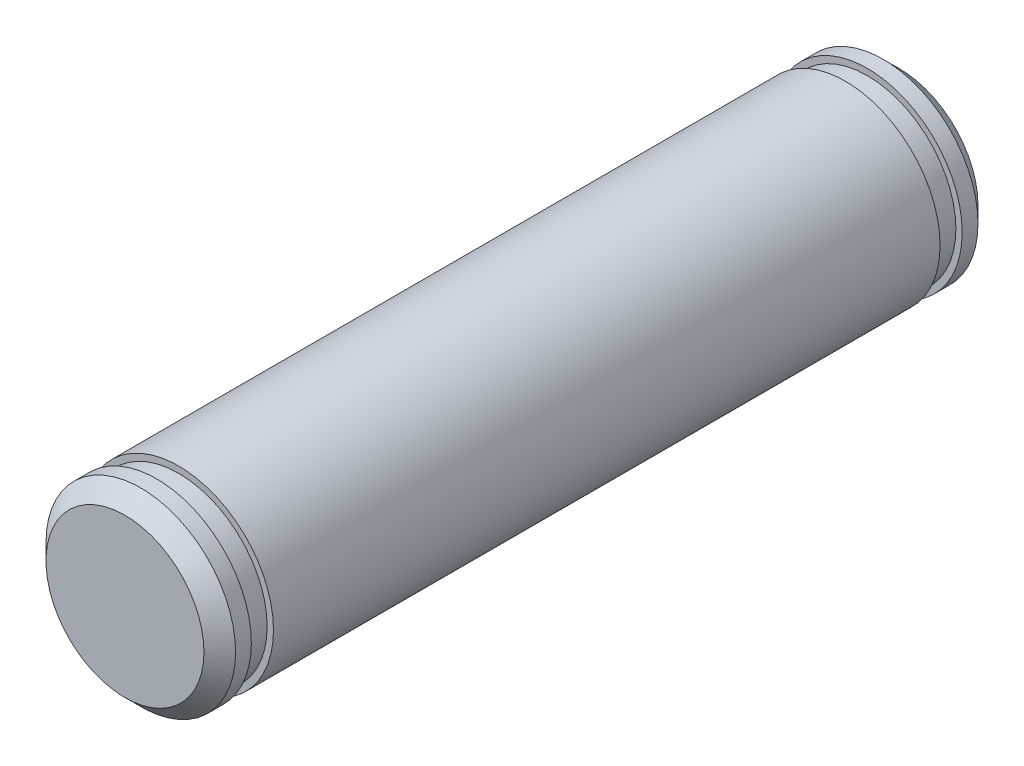
from build123d import *

# Parameters (mm, degrees)
SZKIC1_R                    = 3
DODANIE_WYCI_GNI_CIE1_DEPTH = 24.5
SFAZOWANIE1_SIZE            = 0.5
WYTNIJ_WYCI_GNI_CIE1_START  = -1.7
SZKIC2_R                    = 3
SZKIC2_R_2                  = 2.8
WYTNIJ_WYCI_GNI_CIE1_DEPTH  = 0.7
WYTNIJ_WYCI_GNI_CIE2_START  = -1
SZKIC3_R                    = 3
SZKIC3_R_2                  = 2.8
WYTNIJ_WYCI_GNI_CIE2_DEPTH  = 0.7


with BuildPart() as part:
    # Szkic1 → Dodanie-wyciągnięcie1 (new body)
    with BuildSketch(Plane.XY):
        Circle(SZKIC1_R)
    extrude(amount=DODANIE_WYCI_GNI_CIE1_DEPTH)

    # Sfazowanie1
    sfazowanie1_edges = [part.edges().sort_by_distance(p)[0] for p in [
        (-3, 0, 0),
        (-3, 0, 24.5),
    ]]
    chamfer(sfazowanie1_edges, length=SFAZOWANIE1_SIZE)

    # Szkic2 → Wytnij-wyciągnięcie1 (cut)
    with BuildSketch(Plane.XY.offset(24.5).offset(WYTNIJ_WYCI_GNI_CIE1_START)):
        Circle(SZKIC2_R)
        Circle(SZKIC2_R_2, mode=Mode.SUBTRACT)
    extrude(amount=WYTNIJ_WYCI_GNI_CIE1_DEPTH, mode=Mode.SUBTRACT)

    # Szkic3 → Wytnij-wyciągnięcie2 (cut)
    with BuildSketch(Plane(origin=(0, 0, 0), x_dir=(-1, 0, 0), z_dir=(0, 0, -1)).offset(WYTNIJ_WYCI_GNI_CIE2_START)):
        Circle(SZKIC3_R)
        Circle(SZKIC3_R_2, mode=Mode.SUBTRACT)
    extrude(amount=-WYTNIJ_WYCI_GNI_CIE2_DEPTH, mode=Mode.SUBTRACT)


solid = part.part
